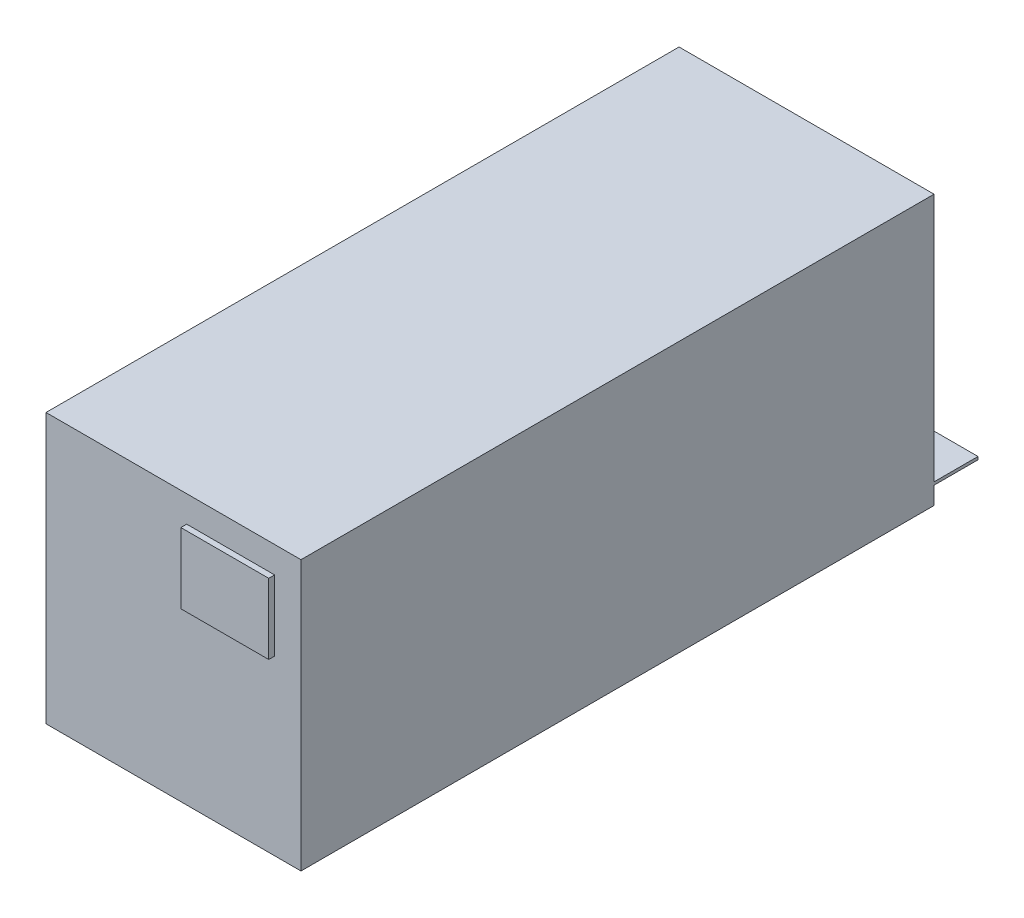
from build123d import *

# Parameters (mm, degrees)
SZKIC1_W                    = 87
SZKIC1_H                    = 92
DODANIE_WYCI_GNI_CIE1_DEPTH = 216
SZKIC2_W                    = 87
SZKIC2_H                    = 1
DODANIE_WYCI_GNI_CIE2_DEPTH = 15
SZKIC3_W                    = 30
SZKIC3_H                    = 24
DODANIE_WYCI_GNI_CIE3_DEPTH = 2
SZKIC4_R                    = 1.5
WYTNIJ_WYCI_GNI_CIE1_DEPTH  = 3


with BuildPart() as part:
    # Szkic1 → Dodanie-wyciągnięcie1 (new body)
    with BuildSketch(Plane.XY):
        Rectangle(SZKIC1_W, SZKIC1_H)
    extrude(amount=DODANIE_WYCI_GNI_CIE1_DEPTH)

    # Szkic2 → Dodanie-wyciągnięcie2 (add)
    with BuildSketch(Plane(origin=(0, 0, 0), x_dir=(-1, 0, 0), z_dir=(0, 0, -1))):
        with Locations((0, -39.5)):
            Rectangle(SZKIC2_W, SZKIC2_H)
    extrude(amount=DODANIE_WYCI_GNI_CIE2_DEPTH)

    # Szkic3 → Dodanie-wyciągnięcie3 (add)
    with BuildSketch(Plane.XY.offset(216)):
        with Locations((19.5, 25)):
            Rectangle(SZKIC3_W, SZKIC3_H)
    extrude(amount=DODANIE_WYCI_GNI_CIE3_DEPTH)

    # Szkic4 → Wytnij-wyciągnięcie1 (cut)
    with BuildSketch(Plane.XZ.offset(46)):
        with Locations((-35.75, 208.75)):
            Circle(SZKIC4_R)
        with Locations((35.75, 208.75)):
            Circle(SZKIC4_R)
        with Locations((-35.75, 7.25)):
            Circle(SZKIC4_R)
        with Locations((35.75, 7.25)):
            Circle(SZKIC4_R)
    extrude(amount=-WYTNIJ_WYCI_GNI_CIE1_DEPTH, mode=Mode.SUBTRACT)


solid = part.part
